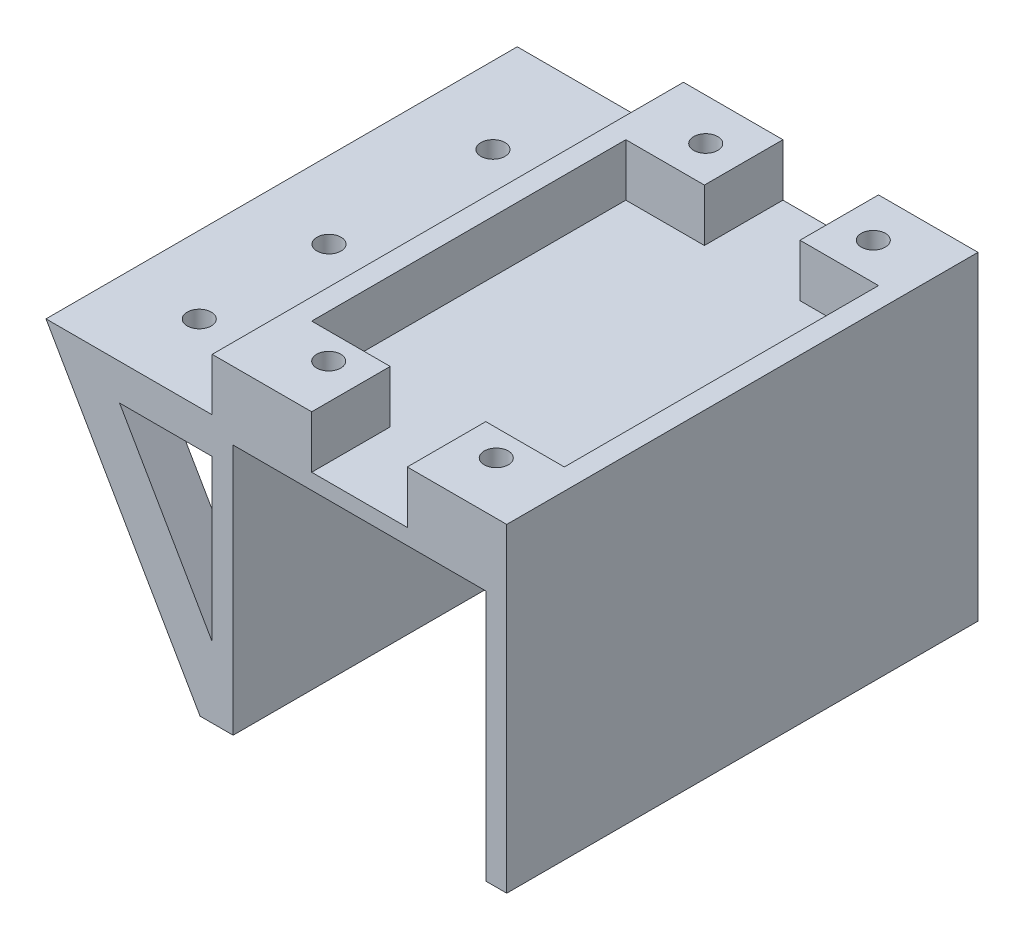
from build123d import *

# Parameters (mm, degrees)
SKETCH1_W            = 48.254
SKETCH1_H            = 10
BOSS_EXTRUDE1_DEPTH  = 70
BOSS_EXTRUDE3_DEPTH  = 8
BOSS_EXTRUDE4_DEPTH  = 8
BOSS_EXTRUDE5_DEPTH  = 8
BOSS_EXTRUDE6_DEPTH  = 70
SKETCH7_W            = 40.394634483
SKETCH7_H            = 17
CUT_EXTRUDE3_DEPTH   = 70
BOSS_EXTRUDE7_DEPTH  = 70
BOSS_EXTRUDE10_DEPTH = 8
BOSS_EXTRUDE11_DEPTH = 70
SKETCH13_W           = 83.001411072
SKETCH13_H           = 87.868559997
CUT_EXTRUDE4_DEPTH   = 4
SKETCH14_W           = 48.254
SKETCH14_H           = 10
BOSS_EXTRUDE12_DEPTH = 20
SKETCH16_W           = 56.254
SKETCH16_H           = 5
CUT_EXTRUDE5_DEPTH   = 100
SKETCH17_W           = 15
SKETCH17_H           = 15
BOSS_EXTRUDE14_DEPTH = 13
CUT_EXTRUDE8_DEPTH   = 5
SKETCH21_R           = 2.3
CUT_EXTRUDE9_DEPTH   = 15
SKETCH23_W           = 12
SKETCH23_H           = 40.530858039
CUT_EXTRUDE10_DEPTH  = 9
SKETCH25_R           = 2.3
CUT_EXTRUDE11_DEPTH  = 20
SKETCH26_R           = 2.3
CUT_EXTRUDE12_DEPTH  = 20
BOSS_EXTRUDE16_DEPTH = 20
SKETCH28_W           = 15
SKETCH28_H           = 15
BOSS_EXTRUDE17_DEPTH = 10
SKETCH29_R           = 2.3
CUT_EXTRUDE13_DEPTH  = 20
SKETCH30_W           = 10.391026801
SKETCH30_H           = 12
BOSS_EXTRUDE18_DEPTH = 5
SKETCH31_R           = 2.3
CUT_EXTRUDE14_DEPTH  = 45


with BuildPart() as part:
    # Sketch1 → Boss-Extrude1 (new body)
    with BuildSketch(Plane.XY):
        Polygon((0, 70), (0, 0), (4, 0), (4, 52), (52.254, 52), (52.254, 0), (56.254, 0), (56.254, 70), align=None)
        with Locations((28.127, 60)):
            Rectangle(SKETCH1_W, SKETCH1_H, mode=Mode.SUBTRACT)
    extrude(amount=BOSS_EXTRUDE1_DEPTH)

    # Sketch3 → Boss-Extrude3 (add)
    with BuildSketch(Plane.XY.offset(70)):
        Polygon((0, 62.5), (0, 70), (-40.394634483, 70), (0, 0.034440722), (0, 17.466679003), (-26, 62.5), align=None)
    extrude(amount=-BOSS_EXTRUDE3_DEPTH)

    # Sketch4 → Boss-Extrude4 (add)
    with BuildSketch(Plane(origin=(0, 0, 0), x_dir=(-1, 0, 0), z_dir=(0, 0, -1))):
        Polygon((0, 70), (40.394634483, 70), (0, 0), (0, 17.466679003), (26, 62.5), (0, 62.5), align=None)
    extrude(amount=-BOSS_EXTRUDE4_DEPTH)

    # Sketch5 → Boss-Extrude5 (add)
    with BuildSketch(Plane(origin=(0, 0, 39), x_dir=(-1, 0, 0), z_dir=(0, 0, -1))):
        Polygon((0, 62.5), (0, 70), (40.394634483, 70), (0, 0), (0, 17.466679003), (26, 62.5), align=None)
    extrude(amount=BOSS_EXTRUDE5_DEPTH)

    # Sketch6 → Boss-Extrude6 (add)
    with BuildSketch(Plane(origin=(0, 0, 0), x_dir=(-1, 0, 0), z_dir=(0, 0, -1))):
        Polygon((0, 62.5), (36.066637932, 62.5), (40.394634483, 70), (0, 70), align=None)
        Polygon((-4, 0), (0, 0), (7.50186069, 13), (-4, 13), align=None)
    extrude(amount=-BOSS_EXTRUDE6_DEPTH)

    # Sketch7 → Cut-Extrude3 (cut)
    with BuildSketch(Plane.XY.offset(70)):
        with Locations((-20.197317242, 61.5)):
            Rectangle(SKETCH7_W, SKETCH7_H)
    extrude(amount=-CUT_EXTRUDE3_DEPTH, mode=Mode.SUBTRACT)

    # Sketch8 → Boss-Extrude7 (add)
    with BuildSketch(Plane(origin=(0, 0, 0), x_dir=(-1, 0, 0), z_dir=(0, 0, -1))):
        Polygon((-4, 55), (-4, 52), (30.007442759, 52), (31.73864138, 55), align=None)
    extrude(amount=-BOSS_EXTRUDE7_DEPTH)

    # Sketch11 → Boss-Extrude10 (add)
    with BuildSketch(Plane.XY.offset(70)):
        Polygon((-31.73864138, 55), (0, 0), (-3.053687451, 13), (-27.288965695, 55), align=None)
    extrude(amount=-BOSS_EXTRUDE10_DEPTH)

    # Sketch12 → Boss-Extrude11 (add)
    with BuildSketch(Plane.XY.offset(70)):
        Polygon((-31.73864138, 55), (-27.75981023, 48.105069917), (0, 48.105069917), (0, 55), align=None)
    extrude(amount=-BOSS_EXTRUDE11_DEPTH)

    # Sketch13 → Cut-Extrude4 (cut)
    with BuildSketch(Plane.XZ):
        with Locations((25.938658228, 33.313825886)):
            Rectangle(SKETCH13_W, SKETCH13_H)
    extrude(amount=-CUT_EXTRUDE4_DEPTH, mode=Mode.SUBTRACT)

    # Sketch14 → Boss-Extrude12 (add)
    with BuildSketch(Plane.XY.offset(70)):
        Polygon((-2.308264828, 4), (-31.73864138, 55), (0, 55), (0, 70), (56.254, 70), (56.254, 4), (52.254, 4), (52.254, 52), (4, 52), (4, 4), align=None)
        Polygon((-17.689083241, 48.105069917), (0, 48.105069917), (0, 17.466679003), align=None, mode=Mode.SUBTRACT)
        with Locations((28.127, 60)):
            Rectangle(SKETCH14_W, SKETCH14_H, mode=Mode.SUBTRACT)
    extrude(amount=BOSS_EXTRUDE12_DEPTH)

    # Sketch16 → Cut-Extrude5 (cut)
    with BuildSketch(Plane.XY.offset(90)):
        with Locations((28.127, 67.5)):
            Rectangle(SKETCH16_W, SKETCH16_H)
    extrude(amount=-CUT_EXTRUDE5_DEPTH, mode=Mode.SUBTRACT)

    # Sketch17 → Boss-Extrude14 (add)
    with BuildSketch(Plane(origin=(0, 65, 0), x_dir=(1, 0, 0), z_dir=(0, 1, 0))):
        with Locations((44.754, -7.5)):
            Rectangle(SKETCH17_W, SKETCH17_H)
        with Locations((44.754, -82.5)):
            Rectangle(SKETCH17_W, SKETCH17_H)
    extrude(amount=-BOSS_EXTRUDE14_DEPTH)

    # Sketch22 → Cut-Extrude8 (cut)
    with BuildSketch(Plane.XZ.offset(-52)):
        Polygon((48.096455918, 6.003620146), (47.904143628, 10.329474511), (44.06168771, 12.325854365), (40.411544082, 9.996379854), (40.603856372, 5.670525489), (44.44631229, 3.674145635), align=None)
        Polygon((45.200685086, 75.774625774), (48.386623963, 78.707166221), (47.439938877, 82.932540447), (43.307314914, 84.225374226), (40.121376037, 81.292833779), (41.068061123, 77.067459553), align=None)
    extrude(amount=-CUT_EXTRUDE8_DEPTH, mode=Mode.SUBTRACT)

    # Sketch21 → Cut-Extrude9 (cut)
    with BuildSketch(Plane(origin=(0, 52, 0), x_dir=(-1, 0, 0), z_dir=(0, -1, 0))):
        with Locations((-44.254, -80)):
            Circle(SKETCH21_R)
        with Locations((-44.254, -8)):
            Circle(SKETCH21_R)
    extrude(amount=-CUT_EXTRUDE9_DEPTH, mode=Mode.SUBTRACT)

    # Sketch23 → Cut-Extrude10 (cut)
    with BuildSketch(Plane(origin=(0, 0, 0), x_dir=(0, 0, 1), z_dir=(-0.8661319205837115, -0.49981546209173167, 0))):
        with Locations((76, 35.274689955)):
            Rectangle(SKETCH23_W, SKETCH23_H)
    extrude(amount=-CUT_EXTRUDE10_DEPTH, mode=Mode.SUBTRACT)

    # Sketch25 → Cut-Extrude11 (cut)
    with BuildSketch(Plane(origin=(0, 48.105069917, 0), x_dir=(-1, 0, 0), z_dir=(0, -1, 0))):
        with Locations((17.075514089, -19.30064897)):
            Circle(SKETCH25_R)
        with Locations((17.075514089, -50.613733273)):
            Circle(SKETCH25_R)
    extrude(amount=-CUT_EXTRUDE11_DEPTH, mode=Mode.SUBTRACT)

    # Sketch26 → Cut-Extrude12 (cut)
    with BuildSketch(Plane.XZ.offset(-48.105069917)):
        with Locations((-17.075514089, 75.391336138)):
            Circle(SKETCH26_R)
    extrude(amount=-CUT_EXTRUDE12_DEPTH, mode=Mode.SUBTRACT)

    # Sketch27 → Boss-Extrude16 (add)
    with BuildSketch(Plane.XY.offset(90)):
        Polygon((-23.310381194, 48.105069917), (-27.75981023, 48.105069917), (-31.73864138, 55), (-23.310381194, 55), align=None)
    extrude(amount=-BOSS_EXTRUDE16_DEPTH)

    # Sketch28 → Boss-Extrude17 (add)
    with BuildSketch(Plane(origin=(0, 55, 0), x_dir=(1, 0, 0), z_dir=(0, 1, 0))):
        with Locations((11.5, -7.5)):
            Rectangle(SKETCH28_W, SKETCH28_H)
        with Locations((11.5, -82.5)):
            Rectangle(SKETCH28_W, SKETCH28_H)
    extrude(amount=BOSS_EXTRUDE17_DEPTH)

    # Sketch29 → Cut-Extrude13 (cut)
    with BuildSketch(Plane(origin=(0, 52, 0), x_dir=(-1, 0, 0), z_dir=(0, -1, 0))):
        with Locations((-12.254, -8)):
            Circle(SKETCH29_R)
        with Locations((-12.254, -80)):
            Circle(SKETCH29_R)
    extrude(amount=-CUT_EXTRUDE13_DEPTH, mode=Mode.SUBTRACT)

    # Sketch30 → Boss-Extrude18 (add)
    with BuildSketch(Plane.XZ.offset(-48.105069917)):
        with Locations((-22.56429683, 76)):
            Rectangle(SKETCH30_W, SKETCH30_H)
    extrude(amount=-BOSS_EXTRUDE18_DEPTH)

    # Sketch31 → Cut-Extrude14 (cut)
    with BuildSketch(Plane.XZ.offset(-48.105069917)):
        with Locations((-17.075514089, 75.391336138)):
            Circle(SKETCH31_R)
    extrude(amount=-CUT_EXTRUDE14_DEPTH, mode=Mode.SUBTRACT)


solid = part.part
